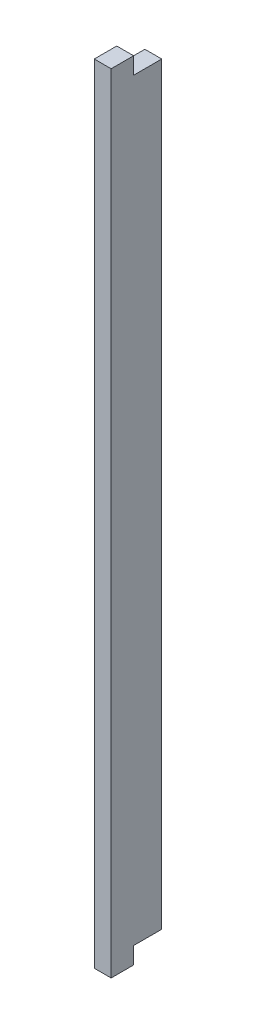
from build123d import *

# Parameters (mm, degrees)
SKETCH1_W           = 4.5
SKETCH1_H           = 70
BOSS_EXTRUDE1_DEPTH = 1.5
SKETCH3_W           = 2.5
SKETCH3_H           = 1.5
CUT_EXTRUDE1_DEPTH  = 2


with BuildPart() as part:
    # Sketch1 → Boss-Extrude1 (new body)
    with BuildSketch(Plane(origin=(0, 0, 0), x_dir=(0, 0, -1), z_dir=(1, 0, 0))):
        with Locations((-2.25, 4.155844156)):
            Rectangle(SKETCH1_W, SKETCH1_H)
    extrude(amount=BOSS_EXTRUDE1_DEPTH)

    # Sketch3 → Cut-Extrude1 (cut)
    with BuildSketch(Plane(origin=(1.5, 0, 0), x_dir=(0, 0, -1), z_dir=(1, 0, 0))):
        with Locations((-1.25, 38.405844156)):
            Rectangle(SKETCH3_W, SKETCH3_H)
        with Locations((-1.25, -30.094155844)):
            Rectangle(SKETCH3_W, SKETCH3_H)
    extrude(amount=-CUT_EXTRUDE1_DEPTH, mode=Mode.SUBTRACT)


solid = part.part
